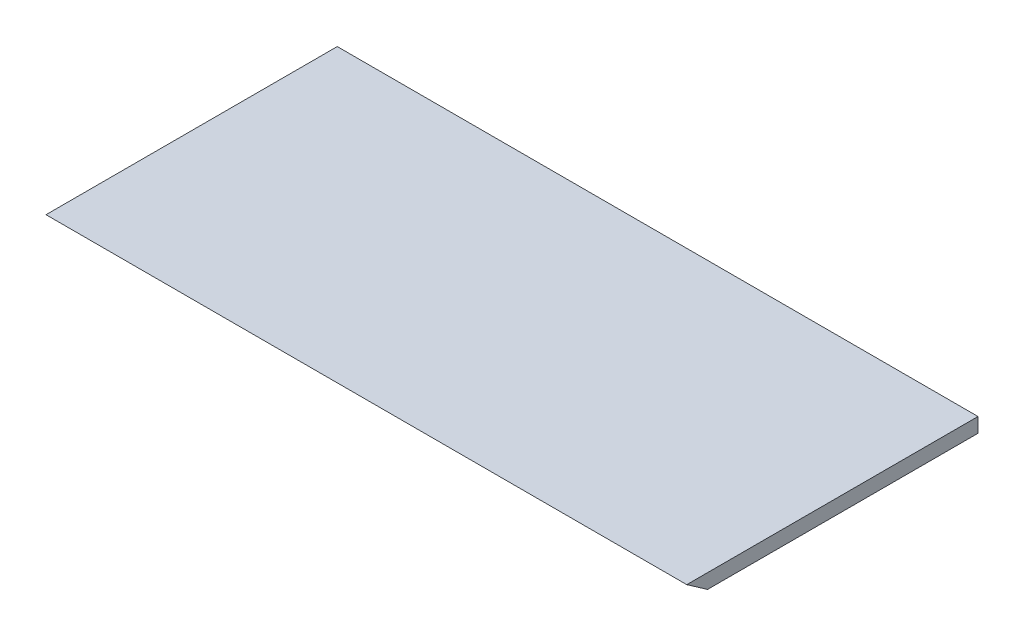
from build123d import *

# Parameters (mm, degrees)
SKETCH1_W           = 139.7
SKETCH1_H           = 63.5
BOSS_EXTRUDE1_DEPTH = 3.175
CHAMFER1_SIZE2      = 4.534369921
CHAMFER1_SIZE       = 3.175


with BuildPart() as part:
    # Sketch1 → Boss-Extrude1 (new body)
    with BuildSketch(Plane(origin=(0, 0, 0), x_dir=(1, 0, 0), z_dir=(0, 1, 0))):
        Rectangle(SKETCH1_W, SKETCH1_H)
    extrude(amount=BOSS_EXTRUDE1_DEPTH)

    # Chamfer1
    chamfer1_edges = [part.edges().sort_by_distance(p)[0] for p in [
        (0, 0, 31.75),
    ]]
    chamfer1_side = [part.faces().sort_by_distance(p)[0] for p in [
        (0, 0.0635, 31.75),
    ]]
    chamfer(chamfer1_edges, length=CHAMFER1_SIZE - 0.0001, length2=CHAMFER1_SIZE2 - 0.0001, reference=chamfer1_side[0])  # a hair under: the kernel refuses the full size


solid = part.part
